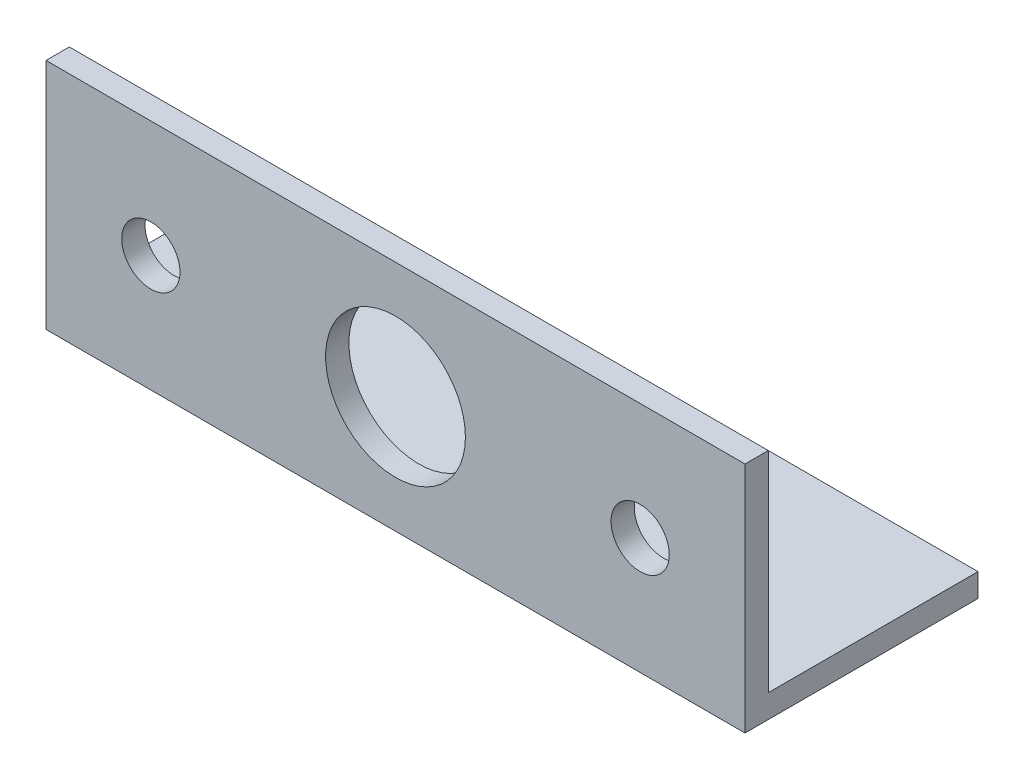
from build123d import *

# Parameters (mm, degrees)
BOSS_EXTRUDE1_DEPTH      = 30
BOSS_EXTRUDE1_DEPTH_BACK = 30
SKETCH2_R                = 2.5
SKETCH2_R_2              = 6
CUT_EXTRUDE1_DEPTH       = 2


with BuildPart() as part:
    # Sketch1 → Boss-Extrude1 (new, two sides: drawn at the far end of the back side and taken through both)
    with BuildSketch(Plane(origin=(0, 0, 0), x_dir=(0, 0, -1), z_dir=(1, 0, 0)).offset(-BOSS_EXTRUDE1_DEPTH_BACK)):
        Polygon((0, 20), (0, 0), (20, 0), (20, 2), (2, 2), (2, 20), align=None)
    extrude(amount=BOSS_EXTRUDE1_DEPTH + BOSS_EXTRUDE1_DEPTH_BACK)

    # Sketch2 → Cut-Extrude1 (cut)
    with BuildSketch(Plane.XY):
        with Locations((-21, 10)):
            Circle(SKETCH2_R)
        with Locations((21, 10)):
            Circle(SKETCH2_R)
        with Locations((0, 10)):
            Circle(SKETCH2_R_2)
    extrude(amount=-CUT_EXTRUDE1_DEPTH, mode=Mode.SUBTRACT)


solid = part.part
